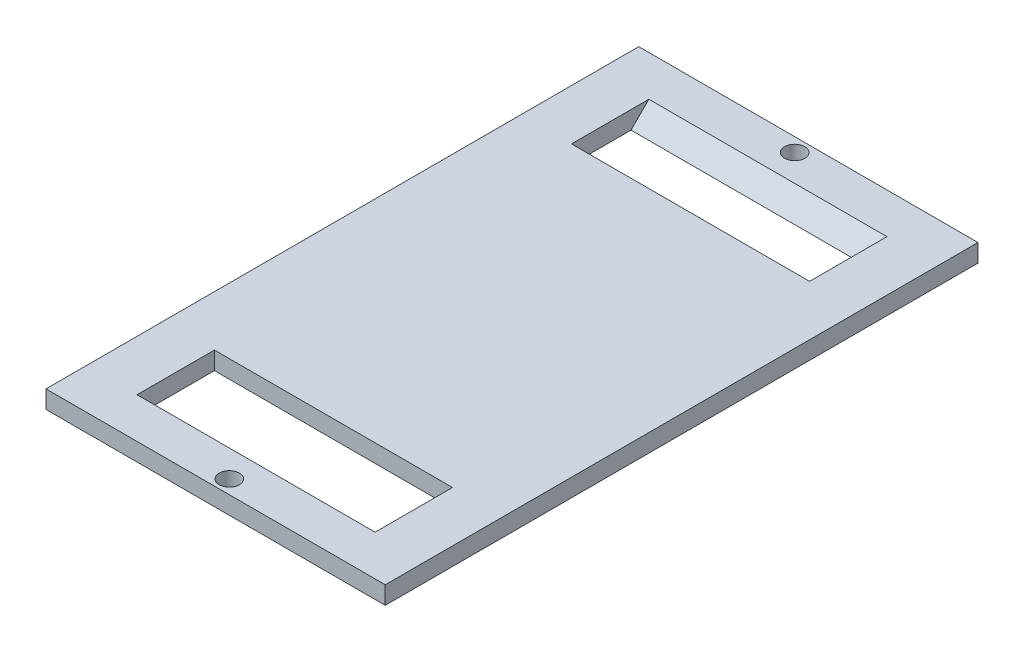
from build123d import *

# Parameters (mm, degrees)
SKETCH_1_W          = 57
SKETCH_1_H          = 99.6
SKETCH_1_R          = 1.7
EXTRUDE_1_DEPTH     = 3
SKETCH_2_W          = 40
SKETCH_2_H          = 10
CUT_EXTRUDE_1_DEPTH = 3
CHAMFER_1_SIZE      = 3


with BuildPart() as part:
    # 草图1 → 凸台-拉伸1 (new body)
    with BuildSketch(Plane(origin=(0, 0, 0), x_dir=(1, 0, 0), z_dir=(0, 1, 0))):
        Rectangle(SKETCH_1_W, SKETCH_1_H)
        with Locations(Location((0, 47.5, 0), (0, 0, 270))):
            Circle(SKETCH_1_R, mode=Mode.SUBTRACT)
        with Locations(Location((0, -47.5, 0), (0, 0, 270))):
            Circle(SKETCH_1_R, mode=Mode.SUBTRACT)
    extrude(amount=EXTRUDE_1_DEPTH)

    # 草图2 → 切除-拉伸1 (cut)
    with BuildSketch(Plane(origin=(0, 3, 0), x_dir=(1, 0, 0), z_dir=(0, 1, 0))):
        with Locations((0, 35)):
            Rectangle(SKETCH_2_W, SKETCH_2_H)
        with Locations((0, -35)):
            Rectangle(SKETCH_2_W, SKETCH_2_H)
    extrude(amount=-CUT_EXTRUDE_1_DEPTH, mode=Mode.SUBTRACT)

    # 倒角1
    chamfer_1_edges = [part.edges().sort_by_distance(p)[0] for p in [
        (0, 3, 40),
        (0, 3, -40),
    ]]
    chamfer(chamfer_1_edges, length=CHAMFER_1_SIZE - 0.0001)  # a hair under: the kernel refuses the full size


solid = part.part
